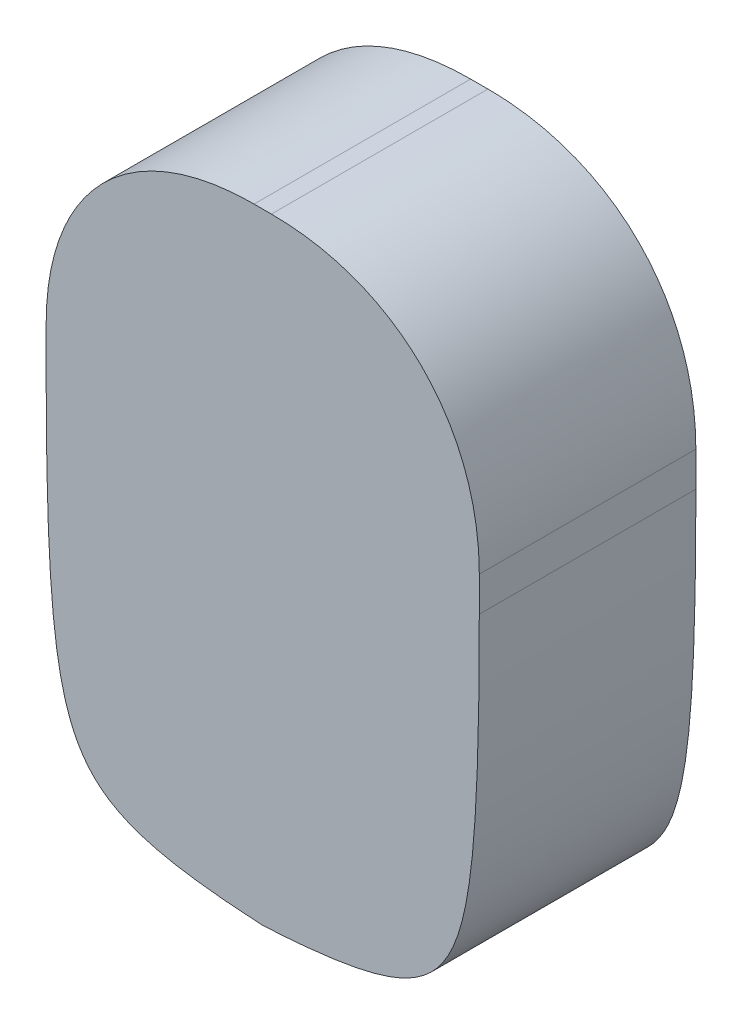
from build123d import *

# Parameters (mm, degrees)
SKETCH1_W           = 250
SKETCH1_H           = 360
BOSS_EXTRUDE7_DEPTH = 125
FILLET5_SIZE        = 220
FILLET3_SIZE        = 120


with BuildPart() as part:
    # Sketch1 → Boss-Extrude7 (new body)
    with BuildSketch(Plane.XY):
        with Locations((-15.989583333, -214.622395833)):
            Rectangle(SKETCH1_W, SKETCH1_H)
    extrude(amount=BOSS_EXTRUDE7_DEPTH)

    # Fillet5
    # a fillet whose section is not a circle: 220 mm, written as the material it takes off along each edge
    with BuildSketch(Plane(origin=(109.010416667, -394.622395833, -550), x_dir=(0, 1, 0), z_dir=(0, 0, 1)), Plane(origin=(-140.989583333, -394.622395833, -550), x_dir=(1, 0, 0), z_dir=(0, 0, 1))) as fillet5_piece_1:
        with BuildLine():
            Bezier((FILLET5_SIZE, 0), (0, 0), (0, FILLET5_SIZE), weights=[1, 3, 1])
            Line((0, FILLET5_SIZE), (0, 0))
            Line((0, 0), (FILLET5_SIZE, 0))
        make_face()
    extrude(amount=1225, mode=Mode.SUBTRACT)

    # Fillet3
    # a fillet whose section is not a circle: 120 mm, written as the material it takes off along each edge
    with BuildSketch(Plane(origin=(109.010416667, -34.622395833, -300), x_dir=(-1, 0, 0), z_dir=(0, 0, 1))) as fillet3_piece_1:
        with BuildLine():
            Bezier((FILLET3_SIZE, 0), (0, 0), (0, FILLET3_SIZE), weights=[1, 0.818181818, 1])
            Line((0, FILLET3_SIZE), (0, 0))
            Line((0, 0), (FILLET3_SIZE, 0))
        make_face()
    extrude(amount=725, mode=Mode.SUBTRACT)
    with BuildSketch(Plane(origin=(-140.989583333, -34.622395833, -300), x_dir=(1, 0, 0), z_dir=(0, 0, 1))) as fillet3_piece_2:
        with BuildLine():
            Bezier((FILLET3_SIZE, 0), (0, 0), (0, -FILLET3_SIZE), weights=[1, 0.818181818, 1])
            Line((0, -FILLET3_SIZE), (0, 0))
            Line((0, 0), (FILLET3_SIZE, 0))
        make_face()
    extrude(amount=725, mode=Mode.SUBTRACT)


solid = part.part
